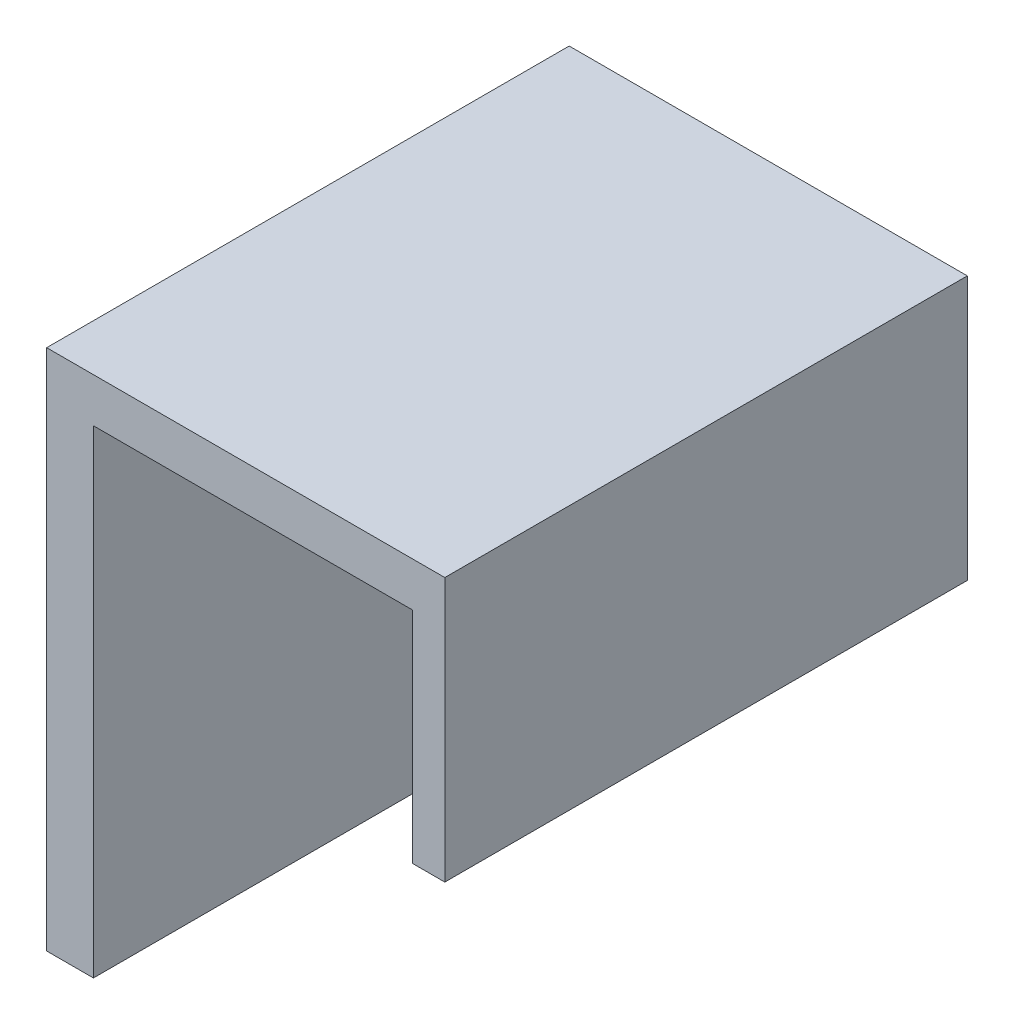
from build123d import *

# Parameters (mm, degrees)
BOSS_EXTRUDE1_DEPTH = 60


with BuildPart() as part:
    # Sketch1 → Boss-Extrude1 (new body)
    with BuildSketch(Plane.XY):
        Polygon((-2.587859425, 20.463258786), (-2.587859425, -4.744408946), (1.150159744, -4.744408946), (1.150159744, 25.54313099), (-44.568690096, 25.54313099), (-44.568690096, -34.45686901), (-39.201277955, -34.45686901), (-39.201277955, 20.463258786), align=None)
    extrude(amount=BOSS_EXTRUDE1_DEPTH)


solid = part.part
